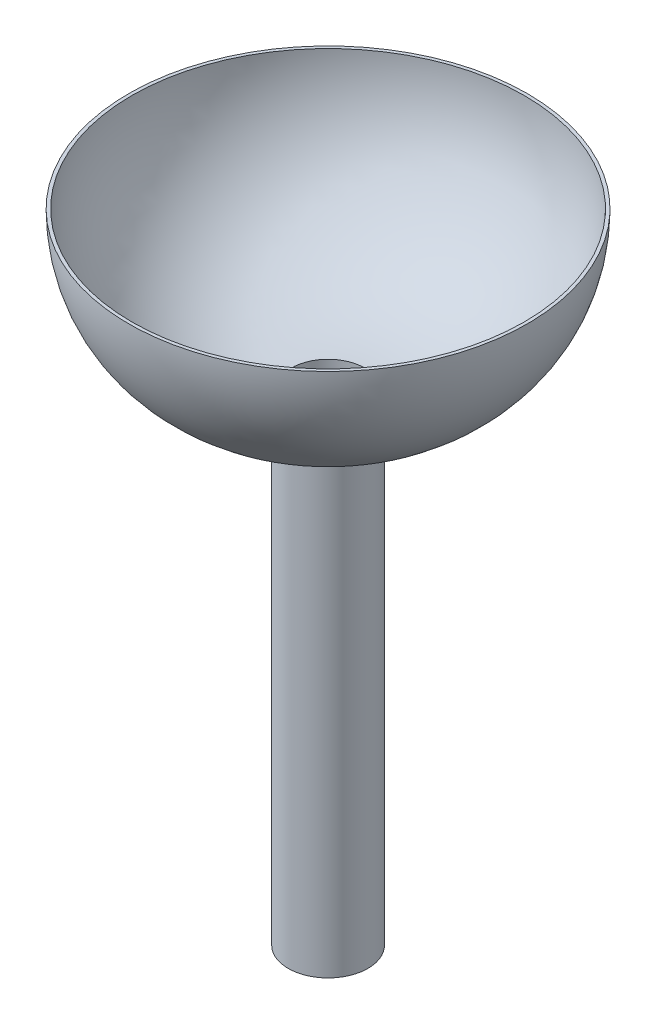
from build123d import *


# Read off the part's stored shape, not the designer's step: Shell1
with BuildPart() as part:
    # Sketch1 → Revolve1 (revolve)
    with BuildSketch(Plane.XY, mode=Mode.PRIVATE) as revolve1_sk:
        with BuildLine():
            Line((-31.75, -508), (0, -508))
            Line((0, -508), (0, -127))
            ThreePointArc((0, -127), (89.802561211, -89.802561211), (127, 0))
            Line((127, 0), (-31.75, 0))
            Line((-31.75, 0), (-31.75, -508))
        make_face()
    revolve(revolve1_sk.sketch.rotate(Axis((-31.75, -508, 0), (0, 1, 0)), 90), axis=Axis((-31.75, -508, 0), (0, 1, 0)))

    # Shell1 outline → Shell1 (revolve, cut)
    with BuildSketch(Plane(origin=(-31.75, 0, 0), x_dir=(1, 0, 0), z_dir=(0, 0, 1))):
        with BuildLine():
            Line((156.21, 0), (0, 0))
            Line((0, 0), (0, -508))
            Line((0, -508), (29.21, -508))
            Line((29.21, -508), (29.21, -124.434078933))
            ThreePointArc((29.21, -124.434078933), (118.853855253, -88.9), (156.21, 0))
        make_face()
    revolve(axis=Axis((-31.75, 0, 0), (0, 1, 0)), mode=Mode.SUBTRACT)


solid = part.part
